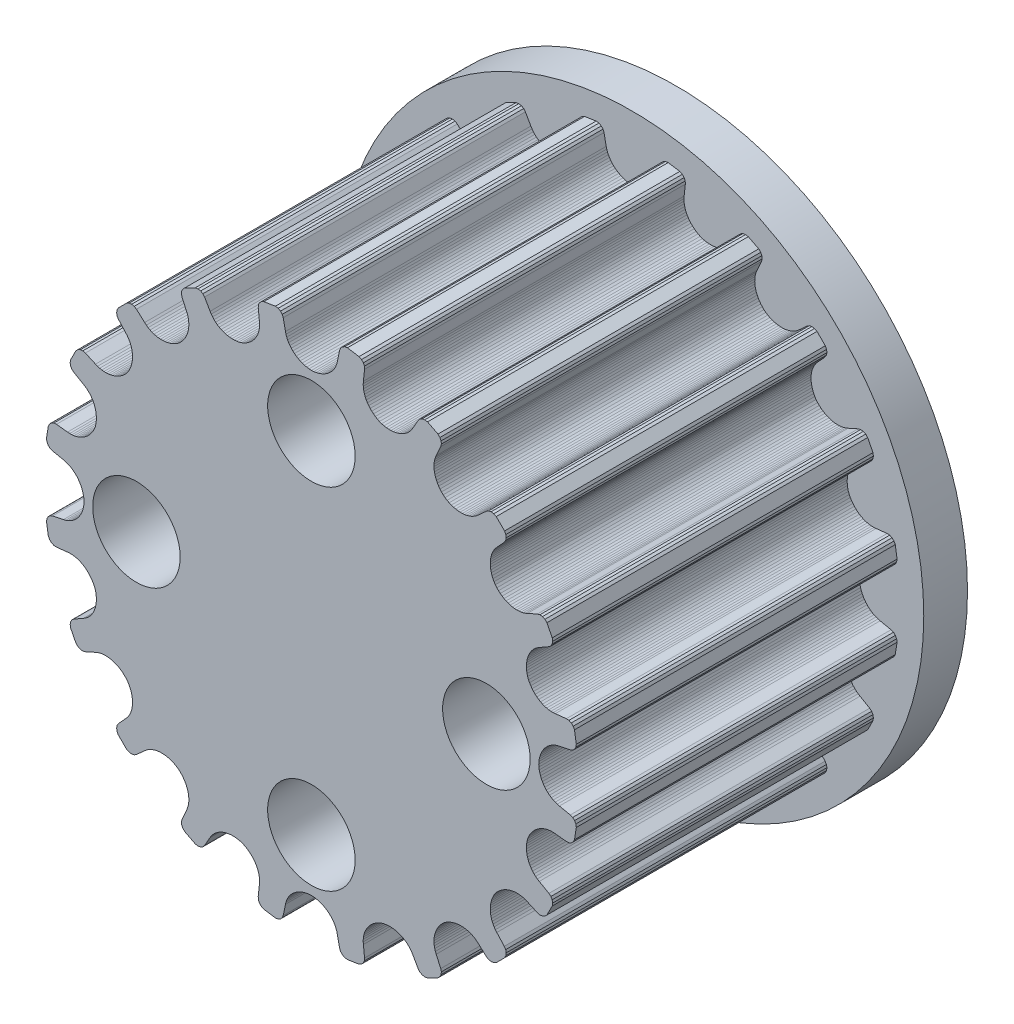
from build123d import *

# Parameters (mm, degrees)
BOSS_EXTRUDE1_DEPTH = 5.5
SKETCH4_R           = 10
BOSS_EXTRUDE2_DEPTH = 1.5
SKETCH2_R           = 2
CUT_EXTRUDE1_DEPTH  = 6
CUT_EXTRUDE2_REACH  = 20.875
SKETCH3_R           = 1.5


with BuildPart() as part:
    # Model → Boss-Extrude1 (new, symmetric)
    with BuildSketch(Plane.XY):
        Polygon((-1.235067463, -9.0847365), (-1.14068626, -9.0692525), (-1.060124, -9.0262195), (-1.000145436, -8.9607625), (-0.967517498, -8.8780085), (-0.889210881, -8.5051225), (-0.871361595, -8.4315045), (-0.846964088, -8.3605765), (-0.816344793, -8.2925995), (-0.779829053, -8.2278335), (-0.737741123, -8.1665375), (-0.690408524, -8.1089725), (-0.638155511, -8.0553985), (-0.581307427, -8.0060745), (-0.520190705, -7.9612605), (-0.455130687, -7.9212165), (-0.386453806, -7.8862035), (-0.314483229, -7.8564795), (-0.239546476, -7.8323065), (-0.16196889, -7.8139435), (-0.082075815, -7.8016495), (-0.000191507, -7.7956865), (0.081696066, -7.8015915), (0.161600022, -7.8138415), (0.239195018, -7.8321755), (0.314153533, -7.8563305), (0.386145872, -7.8860465), (0.45484778, -7.9210615), (0.519930648, -7.9611135), (0.581066956, -8.0059415), (0.637930273, -8.0552845), (0.690193079, -8.1088795), (0.737527855, -8.1664665), (0.779607079, -8.2277835), (0.816103233, -8.2925695), (0.846690974, -8.3605625), (0.871040604, -8.4315005), (0.88882678, -8.5051225), (0.966750383, -8.8780085), (0.999984396, -8.9607625), (1.060171877, -9.0262195), (1.140728696, -9.0692525), (1.235067463, -9.0847365), (1.63271901, -9.021754683), (1.717696048, -8.977863128), (1.781017382, -8.912041205), (1.817833061, -8.831253503), (1.823291682, -8.742467185), (1.782537589, -8.36363345), (1.776764056, -8.288102838), (1.778049506, -8.213107057), (1.786164138, -8.138995206), (1.800878876, -8.066115095), (1.82196537, -7.99481325), (1.849192784, -7.925439104), (1.882333076, -7.858340133), (1.921156862, -7.793863197), (1.965434032, -7.732356445), (2.014935509, -7.674167687), (2.069431492, -7.619646021), (2.128694357, -7.569136686), (2.192493577, -7.522990067), (2.260599767, -7.481553023), (2.332783541, -7.445172417), (2.408817478, -7.414197624), (2.488521933, -7.394508961), (2.568300569, -7.381467723), (2.647763313, -7.374926221), (2.726517403, -7.374735536), (2.804168935, -7.380750275), (2.880328562, -7.392821462), (2.954602796, -7.410801465), (3.026599494, -7.434543269), (3.095927548, -7.463899519), (3.162194196, -7.498721298), (3.225007605, -7.538862539), (3.283975321, -7.584175276), (3.338705201, -7.634512492), (3.388806863, -7.689725546), (3.433885785, -7.749667144), (3.473551893, -7.814189596), (3.662889754, -8.144745538), (3.720069572, -8.213179394), (3.797538592, -8.256833746), (3.887450609, -8.272867135), (3.981956926, -8.258441012), (4.340683569, -8.075660658), (4.407938299, -8.00765796), (4.447820374, -7.925490224), (4.457869392, -7.837279883), (4.435624368, -7.751152269), (4.27979886, -7.403453684), (4.250967662, -7.333403924), (4.229015227, -7.261681472), (4.213830879, -7.188689353), (4.205304233, -7.114829145), (4.203325199, -7.040500975), (4.207782218, -6.966108508), (4.218565786, -6.892052681), (4.235564932, -6.818734262), (4.258668391, -6.746555466), (4.287765778, -6.675917871), (4.322746417, -6.607224501), (4.363500508, -6.540874036), (4.409917082, -6.47727095), (4.461885167, -6.41681601), (4.519293791, -6.359909984), (4.582034624, -6.306955426), (4.651753934, -6.263600364), (4.723597962, -6.226544455), (4.797150087, -6.195767779), (4.871990752, -6.171250074), (4.947700405, -6.152974788), (5.023862716, -6.14092055), (5.100057837, -6.135068549), (5.175867387, -6.135400142), (5.250873864, -6.141896049), (5.324657713, -6.154536008), (5.39680114, -6.173302187), (5.466885177, -6.198175134), (5.534491441, -6.229136208), (5.599202725, -6.266164678), (5.6605983, -6.309242372), (5.718261544, -6.358349369), (6.000479956, -6.614218135), (6.076008418, -6.661633065), (6.163175771, -6.679211577), (6.25364177, -6.666675895), (6.339064702, -6.623751778), (6.623751778, -6.339064702), (6.666700838, -6.253607439), (6.679239718, -6.163137038), (6.661538408, -6.076138702), (6.613767236, -6.001100564), (6.3581236, -5.718572289), (6.309056934, -5.660860338), (6.266015471, -5.599431908), (6.229018493, -5.5347045), (6.198085112, -5.467094146), (6.173234271, -5.397015411), (6.154484611, -5.324886676), (6.141855885, -5.251123093), (6.135366396, -5.176140108), (6.135034617, -5.100354632), (6.140879659, -5.0241827), (6.152920805, -4.948041811), (6.171176828, -4.872345062), (6.195667178, -4.797511422), (6.22641016, -4.723956336), (6.263424076, -4.652095249), (6.306730297, -4.582344488), (6.35963985, -4.519566922), (6.416516675, -4.462123634), (6.476958386, -4.410124418), (6.540559702, -4.363679658), (6.606916486, -4.322903259), (6.675626184, -4.287903549), (6.746283683, -4.258792378), (6.818485317, -4.235681302), (6.891828062, -4.218681), (6.965906634, -4.207901852), (7.040318179, -4.203456004), (7.114658222, -4.205454424), (7.188523098, -4.214008671), (7.261509613, -4.229227952), (7.333212014, -4.251224998), (7.403227915, -4.280109605), (7.750701371, -4.436244977), (7.837185226, -4.457999676), (7.925518365, -4.447781641), (8.007682903, -4.407903968), (8.075660658, -4.340683569), (8.258441012, -3.981956926), (8.272880249, -3.887410249), (8.256848541, -3.797493059), (8.21312963, -3.720222729), (8.144508487, -3.663619324), (7.814070902, -3.473917195), (7.749571756, -3.434192301), (7.689654464, -3.389070936), (7.634466377, -3.338944208), (7.584154235, -3.284201881), (7.538864161, -3.225232375), (7.49874317, -3.162427835), (7.463938337, -3.09617699), (7.434595449, -3.026869296), (7.410860909, -2.954895551), (7.392881453, -2.880645521), (7.380804434, -2.804510313), (7.374775362, -2.726877006), (7.374942203, -2.64813805), (7.381450744, -2.568682903), (7.394446773, -2.488901018), (7.414079266, -2.409181745), (7.444999907, -2.333126781), (7.481342029, -2.260919061), (7.522756872, -2.192787352), (7.568893097, -2.128961873), (7.619401549, -2.069675839), (7.67393285, -2.015156672), (7.732136277, -1.965635935), (7.793662397, -1.921344465), (7.85816211, -1.882512062), (7.92528408, -1.849368945), (7.994679821, -1.82214626), (8.065998949, -1.801074535), (8.138892028, -1.786384604), (8.213009346, -1.778304927), (8.287999842, -1.777068101), (8.363514756, -1.782902891), (8.742230134, -1.824021251), (8.83120374, -1.817986219), (8.912056, -1.780971849), (8.977876241, -1.717655689), (9.021754683, -1.63271901), (9.0847365, -1.235067463), (9.0692525, -1.14068626), (9.0262195, -1.060124), (8.9607625, -1.000145436), (8.8780085, -0.967517498), (8.5051225, -0.889210881), (8.4315045, -0.871361595), (8.3605765, -0.846964088), (8.2925995, -0.816344793), (8.2278335, -0.779829053), (8.1665375, -0.737741123), (8.1089725, -0.690408524), (8.0553985, -0.638155511), (8.0060745, -0.581307427), (7.9612605, -0.520190705), (7.9212165, -0.455130687), (7.8862035, -0.386453806), (7.8564795, -0.314483229), (7.8323065, -0.239546476), (7.8139435, -0.16196889), (7.8016495, -0.082075815), (7.7956865, -0.000191507), (7.8015915, 0.081696066), (7.8138415, 0.161600022), (7.8321755, 0.239195018), (7.8563305, 0.314153533), (7.8860465, 0.386145872), (7.9210615, 0.45484778), (7.9611135, 0.519930648), (8.0059415, 0.581066956), (8.0552845, 0.637930273), (8.1088795, 0.690193079), (8.1664665, 0.737527855), (8.2277835, 0.779607079), (8.2925695, 0.816103233), (8.3605625, 0.846690974), (8.4315005, 0.871040604), (8.5051225, 0.88882678), (8.8780085, 0.966750383), (8.9607625, 0.999984396), (9.0262195, 1.060171877), (9.0692525, 1.140728696), (9.0847365, 1.235067463), (9.021754683, 1.63271901), (8.977863128, 1.717696048), (8.912041205, 1.781017382), (8.831253503, 1.817833061), (8.742467185, 1.823291682), (8.36363345, 1.782537589), (8.288102838, 1.776764056), (8.213107057, 1.778049506), (8.138995206, 1.786164138), (8.066115095, 1.800878876), (7.99481325, 1.82196537), (7.925439104, 1.849192784), (7.858340133, 1.882333076), (7.793863197, 1.921156862), (7.732356445, 1.965434032), (7.674167687, 2.014935509), (7.619646021, 2.069431492), (7.569136686, 2.128694357), (7.522990067, 2.192493577), (7.481553023, 2.260599767), (7.445172417, 2.332783541), (7.414197624, 2.408817478), (7.394508961, 2.488521933), (7.381467723, 2.568300569), (7.374926221, 2.647763313), (7.374735536, 2.726517403), (7.380750275, 2.804168935), (7.392821462, 2.880328562), (7.410801465, 2.954602796), (7.434543269, 3.026599494), (7.463899519, 3.095927548), (7.498721298, 3.162194196), (7.538862539, 3.225007605), (7.584175276, 3.283975321), (7.634512492, 3.338705201), (7.689725546, 3.388806863), (7.749667144, 3.433885785), (7.814189596, 3.473551893), (8.144745538, 3.662889754), (8.213179394, 3.720069572), (8.256833746, 3.797538592), (8.272867135, 3.887450609), (8.258441012, 3.981956926), (8.075660658, 4.340683569), (8.00765796, 4.407938299), (7.925490224, 4.447820374), (7.837279883, 4.457869392), (7.751152269, 4.435624368), (7.403453684, 4.27979886), (7.333403924, 4.250967662), (7.261681472, 4.229015227), (7.188689353, 4.213830879), (7.114829145, 4.205304233), (7.040500975, 4.203325199), (6.966108508, 4.207782218), (6.892052681, 4.218565786), (6.818734262, 4.235564932), (6.746555466, 4.258668391), (6.675917871, 4.287765778), (6.607224501, 4.322746417), (6.540874036, 4.363500508), (6.47727095, 4.409917082), (6.41681601, 4.461885167), (6.359909984, 4.519293791), (6.306955426, 4.582034624), (6.263600364, 4.651753934), (6.226544455, 4.723597962), (6.195767779, 4.797150087), (6.171250074, 4.871990752), (6.152974788, 4.947700405), (6.14092055, 5.023862716), (6.135068549, 5.100057837), (6.135400142, 5.175867387), (6.141896049, 5.250873864), (6.154536008, 5.324657713), (6.173302187, 5.39680114), (6.198175134, 5.466885177), (6.229136208, 5.534491441), (6.266164678, 5.599202725), (6.309242372, 5.6605983), (6.358349369, 5.718261544), (6.614218135, 6.000479956), (6.661633065, 6.076008418), (6.679211577, 6.163175771), (6.666675895, 6.25364177), (6.623751778, 6.339064702), (6.339064702, 6.623751778), (6.253607439, 6.666700838), (6.163137038, 6.679239718), (6.076138702, 6.661538408), (6.001100564, 6.613767236), (5.718572289, 6.3581236), (5.660860338, 6.309056934), (5.599431908, 6.266015471), (5.5347045, 6.229018493), (5.467094146, 6.198085112), (5.397015411, 6.173234271), (5.324886676, 6.154484611), (5.251123093, 6.141855885), (5.176140108, 6.135366396), (5.100354632, 6.135034617), (5.0241827, 6.140879659), (4.948041811, 6.152920805), (4.872345062, 6.171176828), (4.797511422, 6.195667178), (4.723956336, 6.22641016), (4.652095249, 6.263424076), (4.582344488, 6.306730297), (4.519566922, 6.35963985), (4.462123634, 6.416516675), (4.410124418, 6.476958386), (4.363679658, 6.540559702), (4.322903259, 6.606916486), (4.287903549, 6.675626184), (4.258792378, 6.746283683), (4.235681302, 6.818485317), (4.218681, 6.891828062), (4.207901852, 6.965906634), (4.203456004, 7.040318179), (4.205454424, 7.114658222), (4.214008671, 7.188523098), (4.229227952, 7.261509613), (4.251224998, 7.333212014), (4.280109605, 7.403227915), (4.436244977, 7.750701371), (4.457999676, 7.837185226), (4.447781641, 7.925518365), (4.407903968, 8.007682903), (4.340683569, 8.075660658), (3.981956926, 8.258441012), (3.887410249, 8.272880249), (3.797493059, 8.256848541), (3.720222729, 8.21312963), (3.663619324, 8.144508487), (3.473917195, 7.814070902), (3.434192301, 7.749571756), (3.389070936, 7.689654464), (3.338944208, 7.634466377), (3.284201881, 7.584154235), (3.225232375, 7.538864161), (3.162427835, 7.49874317), (3.09617699, 7.463938337), (3.026869296, 7.434595449), (2.954895551, 7.410860909), (2.880645521, 7.392881453), (2.804510313, 7.380804434), (2.726877006, 7.374775362), (2.64813805, 7.374942203), (2.568682903, 7.381450744), (2.488901018, 7.394446773), (2.409181745, 7.414079266), (2.333126781, 7.444999907), (2.260919061, 7.481342029), (2.192787352, 7.522756872), (2.128961873, 7.568893097), (2.069675839, 7.619401549), (2.015156672, 7.67393285), (1.965635935, 7.732136277), (1.921344465, 7.793662397), (1.882512062, 7.85816211), (1.849368945, 7.92528408), (1.82214626, 7.994679821), (1.801074535, 8.065998949), (1.786384604, 8.138892028), (1.778304927, 8.213009346), (1.777068101, 8.287999842), (1.782902891, 8.363514756), (1.824021251, 8.742230134), (1.817986219, 8.83120374), (1.780971849, 8.912056), (1.717655689, 8.977876241), (1.63271901, 9.021754683), (1.235067463, 9.0847365), (1.14068626, 9.0692525), (1.060124, 9.0262195), (1.000145436, 8.9607625), (0.967517498, 8.8780085), (0.889210881, 8.5051225), (0.871361595, 8.4315045), (0.846964088, 8.3605765), (0.816344793, 8.2925995), (0.779829053, 8.2278335), (0.737741123, 8.1665375), (0.690408524, 8.1089725), (0.638155511, 8.0553985), (0.581307427, 8.0060745), (0.520190705, 7.9612605), (0.455130687, 7.9212165), (0.386453806, 7.8862035), (0.314483229, 7.8564795), (0.239546476, 7.8323065), (0.16196889, 7.8139435), (0.082075815, 7.8016495), (0.000191507, 7.7956865), (-0.081696066, 7.8015915), (-0.161600022, 7.8138415), (-0.239195018, 7.8321755), (-0.314153533, 7.8563305), (-0.386145872, 7.8860465), (-0.45484778, 7.9210615), (-0.519930648, 7.9611135), (-0.581066956, 8.0059415), (-0.637930273, 8.0552845), (-0.690193079, 8.1088795), (-0.737527855, 8.1664665), (-0.779607079, 8.2277835), (-0.816103233, 8.2925695), (-0.846690974, 8.3605625), (-0.871040604, 8.4315005), (-0.88882678, 8.5051225), (-0.966750383, 8.8780085), (-0.999984396, 8.9607625), (-1.060171877, 9.0262195), (-1.140728696, 9.0692525), (-1.235067463, 9.0847365), (-1.63271901, 9.021754683), (-1.717696048, 8.977863128), (-1.781017382, 8.912041205), (-1.817833061, 8.831253503), (-1.823291682, 8.742467185), (-1.782537589, 8.36363345), (-1.776764056, 8.288102838), (-1.778049506, 8.213107057), (-1.786164138, 8.138995206), (-1.800878876, 8.066115095), (-1.82196537, 7.99481325), (-1.849192784, 7.925439104), (-1.882333076, 7.858340133), (-1.921156862, 7.793863197), (-1.965434032, 7.732356445), (-2.014935509, 7.674167687), (-2.069431492, 7.619646021), (-2.128694357, 7.569136686), (-2.192493577, 7.522990067), (-2.260599767, 7.481553023), (-2.332783541, 7.445172417), (-2.408817478, 7.414197624), (-2.488521933, 7.394508961), (-2.568300569, 7.381467723), (-2.647763313, 7.374926221), (-2.726517403, 7.374735536), (-2.804168935, 7.380750275), (-2.880328562, 7.392821462), (-2.954602796, 7.410801465), (-3.026599494, 7.434543269), (-3.095927548, 7.463899519), (-3.162194196, 7.498721298), (-3.225007605, 7.538862539), (-3.283975321, 7.584175276), (-3.338705201, 7.634512492), (-3.388806863, 7.689725546), (-3.433885785, 7.749667144), (-3.473551893, 7.814189596), (-3.662889754, 8.144745538), (-3.720069572, 8.213179394), (-3.797538592, 8.256833746), (-3.887450609, 8.272867135), (-3.981956926, 8.258441012), (-4.340683569, 8.075660658), (-4.407938299, 8.00765796), (-4.447820374, 7.925490224), (-4.457869392, 7.837279883), (-4.435624368, 7.751152269), (-4.27979886, 7.403453684), (-4.250967662, 7.333403924), (-4.229015227, 7.261681472), (-4.213830879, 7.188689353), (-4.205304233, 7.114829145), (-4.203325199, 7.040500975), (-4.207782218, 6.966108508), (-4.218565786, 6.892052681), (-4.235564932, 6.818734262), (-4.258668391, 6.746555466), (-4.287765778, 6.675917871), (-4.322746417, 6.607224501), (-4.363500508, 6.540874036), (-4.409917082, 6.47727095), (-4.461885167, 6.41681601), (-4.519293791, 6.359909984), (-4.582034624, 6.306955426), (-4.651753934, 6.263600364), (-4.723597962, 6.226544455), (-4.797150087, 6.195767779), (-4.871990752, 6.171250074), (-4.947700405, 6.152974788), (-5.023862716, 6.14092055), (-5.100057837, 6.135068549), (-5.175867387, 6.135400142), (-5.250873864, 6.141896049), (-5.324657713, 6.154536008), (-5.39680114, 6.173302187), (-5.466885177, 6.198175134), (-5.534491441, 6.229136208), (-5.599202725, 6.266164678), (-5.6605983, 6.309242372), (-5.718261544, 6.358349369), (-6.000479956, 6.614218135), (-6.076008418, 6.661633065), (-6.163175771, 6.679211577), (-6.25364177, 6.666675895), (-6.339064702, 6.623751778), (-6.623751778, 6.339064702), (-6.666700838, 6.253607439), (-6.679239718, 6.163137038), (-6.661538408, 6.076138702), (-6.613767236, 6.001100564), (-6.3581236, 5.718572289), (-6.309056934, 5.660860338), (-6.266015471, 5.599431908), (-6.229018493, 5.5347045), (-6.198085112, 5.467094146), (-6.173234271, 5.397015411), (-6.154484611, 5.324886676), (-6.141855885, 5.251123093), (-6.135366396, 5.176140108), (-6.135034617, 5.100354632), (-6.140879659, 5.0241827), (-6.152920805, 4.948041811), (-6.171176828, 4.872345062), (-6.195667178, 4.797511422), (-6.22641016, 4.723956336), (-6.263424076, 4.652095249), (-6.306730297, 4.582344488), (-6.35963985, 4.519566922), (-6.416516675, 4.462123634), (-6.476958386, 4.410124418), (-6.540559702, 4.363679658), (-6.606916486, 4.322903259), (-6.675626184, 4.287903549), (-6.746283683, 4.258792378), (-6.818485317, 4.235681302), (-6.891828062, 4.218681), (-6.965906634, 4.207901852), (-7.040318179, 4.203456004), (-7.114658222, 4.205454424), (-7.188523098, 4.214008671), (-7.261509613, 4.229227952), (-7.333212014, 4.251224998), (-7.403227915, 4.280109605), (-7.750701371, 4.436244977), (-7.837185226, 4.457999676), (-7.925518365, 4.447781641), (-8.007682903, 4.407903968), (-8.075660658, 4.340683569), (-8.258441012, 3.981956926), (-8.272880249, 3.887410249), (-8.256848541, 3.797493059), (-8.21312963, 3.720222729), (-8.144508487, 3.663619324), (-7.814070902, 3.473917195), (-7.749571756, 3.434192301), (-7.689654464, 3.389070936), (-7.634466377, 3.338944208), (-7.584154235, 3.284201881), (-7.538864161, 3.225232375), (-7.49874317, 3.162427835), (-7.463938337, 3.09617699), (-7.434595449, 3.026869296), (-7.410860909, 2.954895551), (-7.392881453, 2.880645521), (-7.380804434, 2.804510313), (-7.374775362, 2.726877006), (-7.374942203, 2.64813805), (-7.381450744, 2.568682903), (-7.394446773, 2.488901018), (-7.414079266, 2.409181745), (-7.444999907, 2.333126781), (-7.481342029, 2.260919061), (-7.522756872, 2.192787352), (-7.568893097, 2.128961873), (-7.619401549, 2.069675839), (-7.67393285, 2.015156672), (-7.732136277, 1.965635935), (-7.793662397, 1.921344465), (-7.85816211, 1.882512062), (-7.92528408, 1.849368945), (-7.994679821, 1.82214626), (-8.065998949, 1.801074535), (-8.138892028, 1.786384604), (-8.213009346, 1.778304927), (-8.287999842, 1.777068101), (-8.363514756, 1.782902891), (-8.742230134, 1.824021251), (-8.83120374, 1.817986219), (-8.912056, 1.780971849), (-8.977876241, 1.717655689), (-9.021754683, 1.63271901), (-9.0847365, 1.235067463), (-9.0692525, 1.14068626), (-9.0262195, 1.060124), (-8.9607625, 1.000145436), (-8.8780085, 0.967517498), (-8.5051225, 0.889210881), (-8.4315045, 0.871361595), (-8.3605765, 0.846964088), (-8.2925995, 0.816344793), (-8.2278335, 0.779829053), (-8.1665375, 0.737741123), (-8.1089725, 0.690408524), (-8.0553985, 0.638155511), (-8.0060745, 0.581307427), (-7.9612605, 0.520190705), (-7.9212165, 0.455130687), (-7.8862035, 0.386453806), (-7.8564795, 0.314483229), (-7.8323065, 0.239546476), (-7.8139435, 0.16196889), (-7.8016495, 0.082075815), (-7.7956865, 0.000191507), (-7.8015915, -0.081696066), (-7.8138415, -0.161600022), (-7.8321755, -0.239195018), (-7.8563305, -0.314153533), (-7.8860465, -0.386145872), (-7.9210615, -0.45484778), (-7.9611135, -0.519930648), (-8.0059415, -0.581066956), (-8.0552845, -0.637930273), (-8.1088795, -0.690193079), (-8.1664665, -0.737527855), (-8.2277835, -0.779607079), (-8.2925695, -0.816103233), (-8.3605625, -0.846690974), (-8.4315005, -0.871040604), (-8.5051225, -0.88882678), (-8.8780085, -0.966750383), (-8.9607625, -0.999984396), (-9.0262195, -1.060171877), (-9.0692525, -1.140728696), (-9.0847365, -1.235067463), (-9.021754683, -1.63271901), (-8.977863128, -1.717696048), (-8.912041205, -1.781017382), (-8.831253503, -1.817833061), (-8.742467185, -1.823291682), (-8.36363345, -1.782537589), (-8.288102838, -1.776764056), (-8.213107057, -1.778049506), (-8.138995206, -1.786164138), (-8.066115095, -1.800878876), (-7.99481325, -1.82196537), (-7.925439104, -1.849192784), (-7.858340133, -1.882333076), (-7.793863197, -1.921156862), (-7.732356445, -1.965434032), (-7.674167687, -2.014935509), (-7.619646021, -2.069431492), (-7.569136686, -2.128694357), (-7.522990067, -2.192493577), (-7.481553023, -2.260599767), (-7.445172417, -2.332783541), (-7.414197624, -2.408817478), (-7.394508961, -2.488521933), (-7.381467723, -2.568300569), (-7.374926221, -2.647763313), (-7.374735536, -2.726517403), (-7.380750275, -2.804168935), (-7.392821462, -2.880328562), (-7.410801465, -2.954602796), (-7.434543269, -3.026599494), (-7.463899519, -3.095927548), (-7.498721298, -3.162194196), (-7.538862539, -3.225007605), (-7.584175276, -3.283975321), (-7.634512492, -3.338705201), (-7.689725546, -3.388806863), (-7.749667144, -3.433885785), (-7.814189596, -3.473551893), (-8.144745538, -3.662889754), (-8.213179394, -3.720069572), (-8.256833746, -3.797538592), (-8.272867135, -3.887450609), (-8.258441012, -3.981956926), (-8.075660658, -4.340683569), (-8.00765796, -4.407938299), (-7.925490224, -4.447820374), (-7.837279883, -4.457869392), (-7.751152269, -4.435624368), (-7.403453684, -4.27979886), (-7.333403924, -4.250967662), (-7.261681472, -4.229015227), (-7.188689353, -4.213830879), (-7.114829145, -4.205304233), (-7.040500975, -4.203325199), (-6.966108508, -4.207782218), (-6.892052681, -4.218565786), (-6.818734262, -4.235564932), (-6.746555466, -4.258668391), (-6.675917871, -4.287765778), (-6.607224501, -4.322746417), (-6.540874036, -4.363500508), (-6.47727095, -4.409917082), (-6.41681601, -4.461885167), (-6.359909984, -4.519293791), (-6.306955426, -4.582034624), (-6.263600364, -4.651753934), (-6.226544455, -4.723597962), (-6.195767779, -4.797150087), (-6.171250074, -4.871990752), (-6.152974788, -4.947700405), (-6.14092055, -5.023862716), (-6.135068549, -5.100057837), (-6.135400142, -5.175867387), (-6.141896049, -5.250873864), (-6.154536008, -5.324657713), (-6.173302187, -5.39680114), (-6.198175134, -5.466885177), (-6.229136208, -5.534491441), (-6.266164678, -5.599202725), (-6.309242372, -5.6605983), (-6.358349369, -5.718261544), (-6.614218135, -6.000479956), (-6.661633065, -6.076008418), (-6.679211577, -6.163175771), (-6.666675895, -6.25364177), (-6.623751778, -6.339064702), (-6.339064702, -6.623751778), (-6.253607439, -6.666700838), (-6.163137038, -6.679239718), (-6.076138702, -6.661538408), (-6.001100564, -6.613767236), (-5.718572289, -6.3581236), (-5.660860338, -6.309056934), (-5.599431908, -6.266015471), (-5.5347045, -6.229018493), (-5.467094146, -6.198085112), (-5.397015411, -6.173234271), (-5.324886676, -6.154484611), (-5.251123093, -6.141855885), (-5.176140108, -6.135366396), (-5.100354632, -6.135034617), (-5.0241827, -6.140879659), (-4.948041811, -6.152920805), (-4.872345062, -6.171176828), (-4.797511422, -6.195667178), (-4.723956336, -6.22641016), (-4.652095249, -6.263424076), (-4.582344488, -6.306730297), (-4.519566922, -6.35963985), (-4.462123634, -6.416516675), (-4.410124418, -6.476958386), (-4.363679658, -6.540559702), (-4.322903259, -6.606916486), (-4.287903549, -6.675626184), (-4.258792378, -6.746283683), (-4.235681302, -6.818485317), (-4.218681, -6.891828062), (-4.207901852, -6.965906634), (-4.203456004, -7.040318179), (-4.205454424, -7.114658222), (-4.214008671, -7.188523098), (-4.229227952, -7.261509613), (-4.251224998, -7.333212014), (-4.280109605, -7.403227915), (-4.436244977, -7.750701371), (-4.457999676, -7.837185226), (-4.447781641, -7.925518365), (-4.407903968, -8.007682903), (-4.340683569, -8.075660658), (-3.981956926, -8.258441012), (-3.887410249, -8.272880249), (-3.797493059, -8.256848541), (-3.720222729, -8.21312963), (-3.663619324, -8.144508487), (-3.473917195, -7.814070902), (-3.434192301, -7.749571756), (-3.389070936, -7.689654464), (-3.338944208, -7.634466377), (-3.284201881, -7.584154235), (-3.225232375, -7.538864161), (-3.162427835, -7.49874317), (-3.09617699, -7.463938337), (-3.026869296, -7.434595449), (-2.954895551, -7.410860909), (-2.880645521, -7.392881453), (-2.804510313, -7.380804434), (-2.726877006, -7.374775362), (-2.64813805, -7.374942203), (-2.568682903, -7.381450744), (-2.488901018, -7.394446773), (-2.409181745, -7.414079266), (-2.333126781, -7.444999907), (-2.260919061, -7.481342029), (-2.192787352, -7.522756872), (-2.128961873, -7.568893097), (-2.069675839, -7.619401549), (-2.015156672, -7.67393285), (-1.965635935, -7.732136277), (-1.921344465, -7.793662397), (-1.882512062, -7.85816211), (-1.849368945, -7.92528408), (-1.82214626, -7.994679821), (-1.801074535, -8.065998949), (-1.786384604, -8.138892028), (-1.778304927, -8.213009346), (-1.777068101, -8.287999842), (-1.782902891, -8.363514756), (-1.824021251, -8.742230134), (-1.817986219, -8.83120374), (-1.780971849, -8.912056), (-1.717655689, -8.977876241), (-1.63271901, -9.021754683), align=None)
    extrude(amount=BOSS_EXTRUDE1_DEPTH, both=True)

    # Sketch4 → Boss-Extrude2 (add)
    with BuildSketch(Plane(origin=(0, 0, -5.5), x_dir=(-1, 0, 0), z_dir=(0, 0, -1))):
        Circle(SKETCH4_R)
    extrude(amount=BOSS_EXTRUDE2_DEPTH)

    # Sketch2 → Cut-Extrude1 (cut)
    with BuildSketch(Plane(origin=(0, 0, -7), x_dir=(-1, 0, 0), z_dir=(0, 0, -1))):
        Circle(SKETCH2_R)
    extrude(amount=-CUT_EXTRUDE1_DEPTH, mode=Mode.SUBTRACT)

    # Sketch3 → Cut-Extrude2 (cut, up to next)
    with BuildSketch(Plane.XY.offset(5.5), mode=Mode.PRIVATE) as cut_extrude2_sk1:
        with Locations((0, 6)):
            Circle(SKETCH3_R)
    cut_extrude2_tool1 = extrude(cut_extrude2_sk1.sketch, amount=-CUT_EXTRUDE2_REACH, mode=Mode.PRIVATE) & part.part
    # Sketch3 → Cut-Extrude2 (cut, up to next)
    with BuildSketch(Plane.XY.offset(5.5), mode=Mode.PRIVATE) as cut_extrude2_sk2:
        with Locations((6, 0)):
            Circle(SKETCH3_R)
    cut_extrude2_tool2 = extrude(cut_extrude2_sk2.sketch, amount=-CUT_EXTRUDE2_REACH, mode=Mode.PRIVATE) & part.part
    # Sketch3 → Cut-Extrude2 (cut, up to next)
    with BuildSketch(Plane.XY.offset(5.5), mode=Mode.PRIVATE) as cut_extrude2_sk3:
        with Locations((0, -6)):
            Circle(SKETCH3_R)
    cut_extrude2_tool3 = extrude(cut_extrude2_sk3.sketch, amount=-CUT_EXTRUDE2_REACH, mode=Mode.PRIVATE) & part.part
    # Sketch3 → Cut-Extrude2 (cut, up to next)
    with BuildSketch(Plane.XY.offset(5.5), mode=Mode.PRIVATE) as cut_extrude2_sk4:
        with Locations((-6, 0)):
            Circle(SKETCH3_R)
    cut_extrude2_tool4 = extrude(cut_extrude2_sk4.sketch, amount=-CUT_EXTRUDE2_REACH, mode=Mode.PRIVATE) & part.part
    add(cut_extrude2_tool1.solids().sort_by_distance((0, 6, 5.5))[0], mode=Mode.SUBTRACT)
    add(cut_extrude2_tool2.solids().sort_by_distance((6, 0, 5.5))[0], mode=Mode.SUBTRACT)
    add(cut_extrude2_tool3.solids().sort_by_distance((0, -6, 5.5))[0], mode=Mode.SUBTRACT)
    add(cut_extrude2_tool4.solids().sort_by_distance((-6, 0, 5.5))[0], mode=Mode.SUBTRACT)


solid = part.part
